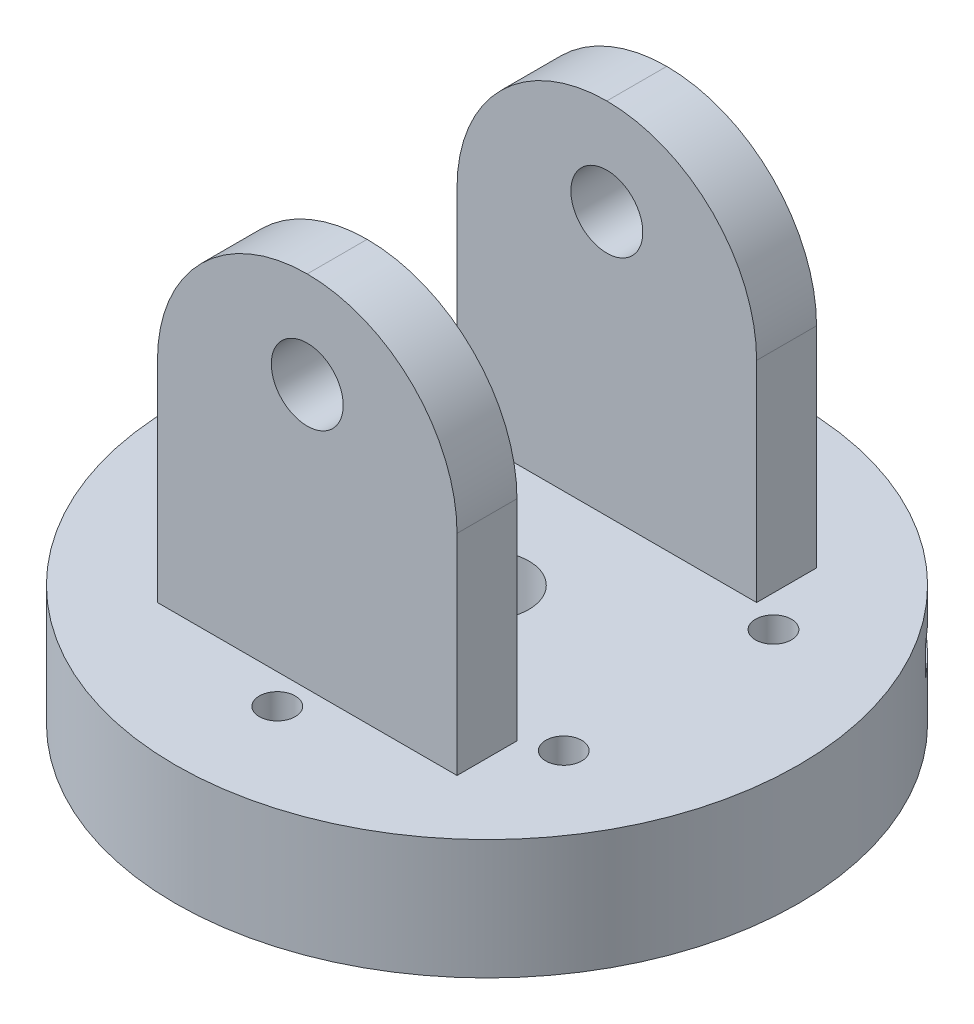
from build123d import *

# Parameters (mm, degrees)
ESQUISSE1_R                        = 52
ESQUISSE1_R_2                      = 7
BOSS_EXTRU_1_DEPTH                 = 20
ESQUISSE2_W                        = 50
ESQUISSE2_H                        = 10
BOSS_EXTRU_2_DEPTH                 = 60
CONG_1_R                           = 25
ESQUISSE3_R                        = 6
ENL_V_MAT_EXTRU_1_DEPTH            = 40
R_P_TITION_CIRCULAIRE1_COUNT       = 2
CONG_1_OF_R_P_TITION_CIRCULAIRE1_R = 25
ESQUISSE5_R                        = 1.6
ENL_V_MAT_EXTRU_2_DEPTH            = 20
R_P_TITION_CIRCULAIRE2_COUNT       = 6
ESQUISSE6_R                        = 3
ENL_V_MAT_EXTRU_3_DEPTH            = 9
ENL_V_START                        = -10
ESQUISSE7_W                        = 80.1
ESQUISSE7_H                        = 5
ENL_V_MAT_EXTRU_4_DEPTH            = 45


with BuildPart() as part:
    # Esquisse1 → Boss.-Extru.1 (new body)
    with BuildSketch(Plane(origin=(0, 0, 0), x_dir=(1, 0, 0), z_dir=(0, 1, 0))):
        with Locations(Location((0, 0, 0), (0, 0, 270))):
            Circle(ESQUISSE1_R)
        with Locations(Location((0, 0, 0), (0, 0, 270))):
            Circle(ESQUISSE1_R_2, mode=Mode.SUBTRACT)
    extrude(amount=BOSS_EXTRU_1_DEPTH)

    # Esquisse2 → Boss.-Extru.2 (add)
    with BuildSketch(Plane(origin=(0, 20, 0), x_dir=(1, 0, 0), z_dir=(0, 1, 0))):
        with Locations((0, 25)):
            Rectangle(ESQUISSE2_W, ESQUISSE2_H)
    boss_extru_2 = extrude(amount=BOSS_EXTRU_2_DEPTH)

    # Congé1
    cong_1_edges = [part.edges().sort_by_distance(p)[0] for p in [
        (25, 80, -25),
        (-25, 80, -25),
    ]]
    fillet(cong_1_edges, radius=CONG_1_R - 0.0001)  # a hair under: the kernel refuses the full size

    # Esquisse3 → Enlèv. mat.-Extru.1 (cut)
    with BuildSketch(Plane(origin=(0, 0, -30), x_dir=(-1, 0, 0), z_dir=(0, 0, -1))):
        with Locations((0, 64)):
            Circle(ESQUISSE3_R)
    enl_v_mat_extru_1 = extrude(amount=-ENL_V_MAT_EXTRU_1_DEPTH, mode=Mode.SUBTRACT)

    # Répétition circulaire1: Boss.-Extru.2, Enlèv. mat.-Extru.1 ×2 about axis
    r_p_tition_circulaire1_axis = Axis((0, 0, 0), (0, 1, 0))
    add([boss_extru_2.rotate(r_p_tition_circulaire1_axis, i * 360 / R_P_TITION_CIRCULAIRE1_COUNT) for i in range(1, R_P_TITION_CIRCULAIRE1_COUNT)])
    add([enl_v_mat_extru_1.rotate(r_p_tition_circulaire1_axis, i * 360 / R_P_TITION_CIRCULAIRE1_COUNT) for i in range(1, R_P_TITION_CIRCULAIRE1_COUNT)], mode=Mode.SUBTRACT)

    # Congé1 of Répétition circulaire1
    cong_1_of_r_p_tition_circulaire1_edges = [part.edges().sort_by_distance(p)[0] for p in [
        (-25, 80, 25),
        (25, 80, 25),
    ]]
    fillet(cong_1_of_r_p_tition_circulaire1_edges, radius=CONG_1_OF_R_P_TITION_CIRCULAIRE1_R - 0.0001)  # a hair under: the kernel refuses the full size

    # Esquisse5 → Enlèv. mat.-Extru.2 (cut)
    with BuildSketch(Plane.XZ):
        with Locations(Location((0, 35, 0), (0, 0, 270))):
            Circle(ESQUISSE5_R)
    enl_v_mat_extru_2 = extrude(amount=-ENL_V_MAT_EXTRU_2_DEPTH, mode=Mode.SUBTRACT)

    # Répétition circulaire2: Enlèv. mat.-Extru.2 ×6 about axis
    r_p_tition_circulaire2_axis = Axis((0, 0, 0), (0, 1, 0))
    for i in range(1, R_P_TITION_CIRCULAIRE2_COUNT):
        add(enl_v_mat_extru_2.rotate(r_p_tition_circulaire2_axis, i * 360 / R_P_TITION_CIRCULAIRE2_COUNT), mode=Mode.SUBTRACT)

    # Esquisse6 → Enlèv. mat.-Extru.3 (cut)
    with BuildSketch(Plane(origin=(0, 20, 0), x_dir=(1, 0, 0), z_dir=(0, 1, 0))):
        with Locations(Location((30.310889132, 17.5, 0), (0, 0, 270))):
            Circle(ESQUISSE6_R)
        with Locations(Location((30.310889132, -17.5, 0), (0, 0, 270))):
            Circle(ESQUISSE6_R)
        with Locations(Location((0, -35, 0), (0, 0, 270))):
            Circle(ESQUISSE6_R)
        with Locations(Location((-30.310889132, -17.5, 0), (0, 0, 270))):
            Circle(ESQUISSE6_R)
        with Locations(Location((-30.310889132, 17.5, 0), (0, 0, 270))):
            Circle(ESQUISSE6_R)
        with Locations(Location((0, 35, 0), (0, 0, 270))):
            Circle(ESQUISSE6_R)
    extrude(amount=-ENL_V_MAT_EXTRU_3_DEPTH, mode=Mode.SUBTRACT)

    # Esquisse7 → Enlèv. mat.-Extru.4 (cut)
    with BuildSketch(Plane.XY.offset(ENL_V_START)):
        with Locations((0, 12.5)):
            Rectangle(ESQUISSE7_W, ESQUISSE7_H)
    extrude(amount=-ENL_V_MAT_EXTRU_4_DEPTH, mode=Mode.SUBTRACT)


solid = part.part
